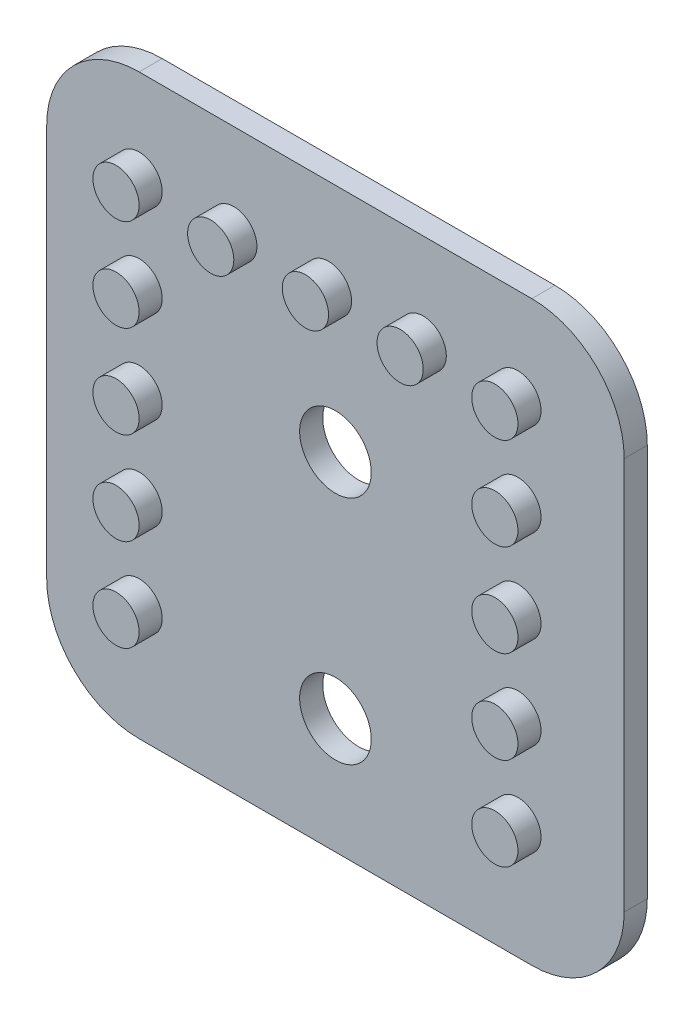
from build123d import *

# Parameters (mm, degrees)
SKETCH1_W           = 25
SKETCH1_H           = 25
BOSS_EXTRUDE1_DEPTH = 1
SKETCH2_R           = 1
BOSS_EXTRUDE2_DEPTH = 1
FILLET1_R           = 4
CUT_EXTRUDE1_REACH  = 50.847
SKETCH3_R           = 1.55


with BuildPart() as part:
    # Sketch1 → Boss-Extrude1 (new body)
    with BuildSketch(Plane.XY):
        with Locations((-23.5, 20.5)):
            Rectangle(SKETCH1_W, SKETCH1_H)
    extrude(amount=BOSS_EXTRUDE1_DEPTH)

    # Sketch2 → Boss-Extrude2 (add)
    with BuildSketch(Plane.XY.offset(1)):
        with Locations((-32, 29)):
            Circle(SKETCH2_R)
        with Locations((-27.9, 29)):
            Circle(SKETCH2_R)
        with Locations((-23.8, 29)):
            Circle(SKETCH2_R)
        with Locations((-19.7, 29)):
            Circle(SKETCH2_R)
        with Locations((-15.6, 29)):
            Circle(SKETCH2_R)
        with Locations((-32, 25)):
            Circle(SKETCH2_R)
        with Locations((-15.6, 25)):
            Circle(SKETCH2_R)
        with Locations((-32, 21)):
            Circle(SKETCH2_R)
        with Locations((-15.6, 21)):
            Circle(SKETCH2_R)
        with Locations((-32, 17)):
            Circle(SKETCH2_R)
        with Locations((-15.6, 17)):
            Circle(SKETCH2_R)
        with Locations((-32, 13)):
            Circle(SKETCH2_R)
        with Locations((-15.6, 13)):
            Circle(SKETCH2_R)
    extrude(amount=BOSS_EXTRUDE2_DEPTH)

    # Fillet1
    fillet1_edges = [part.edges().sort_by_distance(p)[0] for p in [
        (-36, 8, 0.5),
        (-11, 8, 0.5),
        (-11, 33, 0.5),
        (-36, 33, 0.5),
    ]]
    fillet(fillet1_edges, radius=FILLET1_R)

    # Sketch3 → Cut-Extrude1 (cut, up to next)
    with BuildSketch(Plane.XY.offset(1), mode=Mode.PRIVATE) as cut_extrude1_sk1:
        with Locations((-23.5, 23)):
            Circle(SKETCH3_R)
    cut_extrude1_tool1 = extrude(cut_extrude1_sk1.sketch, amount=-CUT_EXTRUDE1_REACH, mode=Mode.PRIVATE) & part.part
    # Sketch3 → Cut-Extrude1 (cut, up to next)
    with BuildSketch(Plane.XY.offset(1), mode=Mode.PRIVATE) as cut_extrude1_sk2:
        with Locations((-23.5, 13)):
            Circle(SKETCH3_R)
    cut_extrude1_tool2 = extrude(cut_extrude1_sk2.sketch, amount=-CUT_EXTRUDE1_REACH, mode=Mode.PRIVATE) & part.part
    add(cut_extrude1_tool1.solids().sort_by_distance((-23.5, 23, 1))[0], mode=Mode.SUBTRACT)
    add(cut_extrude1_tool2.solids().sort_by_distance((-23.5, 13, 1))[0], mode=Mode.SUBTRACT)


solid = part.part
